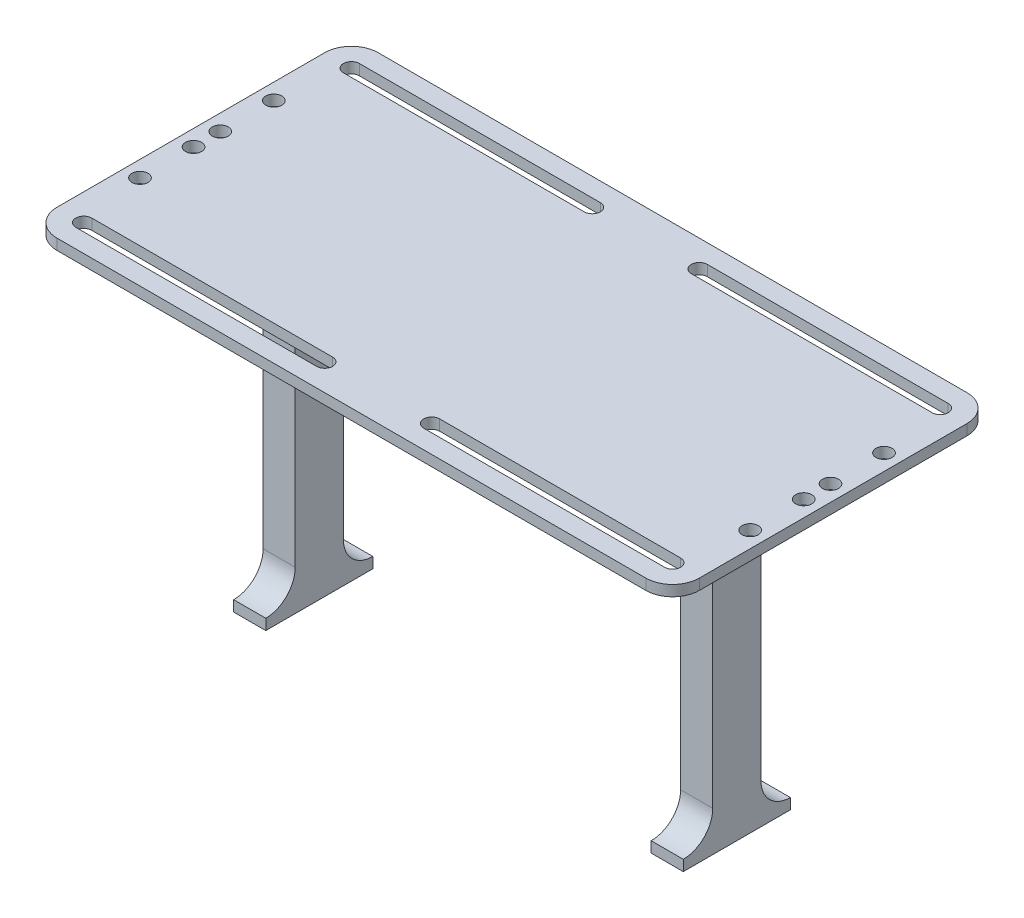
from build123d import *

# Parameters (mm, degrees)
SKETCH1_W             = 6
SKETCH1_H             = 9
BOSS_EXTRUDE1_DEPTH   = 60
BOSS_EXTRUDE1_2_DEPTH = 60
SKETCH2_W             = 6
SKETCH2_H             = 20
BOSS_EXTRUDE2_DEPTH   = 2
SKETCH3_R             = 1.4
CUT_EXTRUDE1_DEPTH    = 6
FILLET1_R             = 5.5
FILLET2_R             = 5.5
SKETCH4_R             = 1.5
BOSS_EXTRUDE4_DEPTH   = 2
FILLET4_R             = 10


with BuildPart() as part:
    # Sketch1 → Boss-Extrude1 (new body)
    with BuildSketch(Plane(origin=(0, 0, 0), x_dir=(1, 0, 0), z_dir=(0, 1, 0))):
        with Locations((39, 0)):
            Rectangle(SKETCH1_W, SKETCH1_H)
    extrude(amount=BOSS_EXTRUDE1_DEPTH)



with BuildPart() as body_2:
    # Sketch1 → Boss-Extrude1 2 (new body)
    with BuildSketch(Plane(origin=(0, 0, 0), x_dir=(1, 0, 0), z_dir=(0, 1, 0))):
        with Locations((-39, 0)):
            Rectangle(SKETCH1_W, SKETCH1_H)
    extrude(amount=BOSS_EXTRUDE1_2_DEPTH)


with BuildPart() as part_1:
    add(part.part)

    add(body_2.part)  # Boss-Extrude2 merges body 2
    # Sketch2 → Boss-Extrude2 (add)
    with BuildSketch(Plane.XZ):
        with Locations((-39, 0)):
            Rectangle(SKETCH2_W, SKETCH2_H)
        with Locations((39, 0)):
            Rectangle(SKETCH2_W, SKETCH2_H)
    extrude(amount=BOSS_EXTRUDE2_DEPTH)

    # Sketch3 → Cut-Extrude1 (cut)
    with BuildSketch(Plane.XZ.offset(2)):
        with Locations(Location((39, 0, 0), (0, 0, 270))):
            Circle(SKETCH3_R)
        with Locations(Location((-39, 0, 0), (0, 0, 270))):
            Circle(SKETCH3_R)
    extrude(amount=-CUT_EXTRUDE1_DEPTH, mode=Mode.SUBTRACT)

    # Fillet1
    fillet1_edges = [part_1.edges().sort_by_distance(p)[0] for p in [
        (-39, 0, -4.5),
        (-39, 0, 4.5),
    ]]
    fillet(fillet1_edges, radius=FILLET1_R - 0.0001)  # a hair under: the kernel refuses the full size

    # Fillet2
    fillet2_edges = [part_1.edges().sort_by_distance(p)[0] for p in [
        (39, 0, -4.5),
        (39, 0, 4.5),
    ]]
    fillet(fillet2_edges, radius=FILLET2_R - 0.0001)  # a hair under: the kernel refuses the full size

    # Sketch4 → Boss-Extrude4 (add)
    with BuildSketch(Plane(origin=(0, 60, 0), x_dir=(1, 0, 0), z_dir=(0, 1, 0))):
        with BuildLine():
            Line((-55, 30), (55, 30))
            ThreePointArc((55, 30), (58.535533906, 28.535533906), (60, 25))
            Line((60, 25), (60, -25))
            ThreePointArc((60, -25), (58.535533906, -28.535533906), (55, -30))
            Line((55, -30), (-55, -30))
            ThreePointArc((-55, -30), (-58.535533906, -28.535533906), (-60, -25))
            Line((-60, -25), (-60, 25))
            ThreePointArc((-60, 25), (-58.535533906, 28.535533906), (-55, 30))
        make_face()
        with Locations(Location((-57, -2.5, 0), (0, 0, 270))):
            Circle(SKETCH4_R, mode=Mode.SUBTRACT)
        with Locations(Location((-57, -12.5, 0), (0, 0, 270))):
            Circle(SKETCH4_R, mode=Mode.SUBTRACT)
        with Locations(Location((57, -12.5, 0), (0, 0, 270))):
            Circle(SKETCH4_R, mode=Mode.SUBTRACT)
        with Locations(Location((57, -2.5, 0), (0, 0, 270))):
            Circle(SKETCH4_R, mode=Mode.SUBTRACT)
        with Locations(Location((57, 2.5, 0), (0, 0, 270))):
            Circle(SKETCH4_R, mode=Mode.SUBTRACT)
        with Locations(Location((57, 12.5, 0), (0, 0, 270))):
            Circle(SKETCH4_R, mode=Mode.SUBTRACT)
        with Locations(Location((-57, 12.5, 0), (0, 0, 270))):
            Circle(SKETCH4_R, mode=Mode.SUBTRACT)
        with Locations(Location((-57, 2.5, 0), (0, 0, 270))):
            Circle(SKETCH4_R, mode=Mode.SUBTRACT)
        with BuildLine():
            Line((55, 23.5), (10, 23.5))
            ThreePointArc((10, 23.5), (8.5, 25), (10, 26.5))
            Line((10, 26.5), (55, 26.5))
            ThreePointArc((55, 26.5), (56.5, 25), (55, 23.5))
        make_face(mode=Mode.SUBTRACT)
        with BuildLine():
            Line((-55, -23.5), (-10, -23.5))
            ThreePointArc((-10, -23.5), (-8.5, -25), (-10, -26.5))
            Line((-10, -26.5), (-55, -26.5))
            ThreePointArc((-55, -26.5), (-56.5, -25), (-55, -23.5))
        make_face(mode=Mode.SUBTRACT)
        with BuildLine():
            Line((-55, 23.5), (-10, 23.5))
            ThreePointArc((-10, 23.5), (-8.5, 25), (-10, 26.5))
            Line((-10, 26.5), (-55, 26.5))
            ThreePointArc((-55, 26.5), (-56.5, 25), (-55, 23.5))
        make_face(mode=Mode.SUBTRACT)
        with BuildLine():
            Line((55, -23.5), (10, -23.5))
            ThreePointArc((10, -23.5), (8.5, -25), (10, -26.5))
            Line((10, -26.5), (55, -26.5))
            ThreePointArc((55, -26.5), (56.5, -25), (55, -23.5))
        make_face(mode=Mode.SUBTRACT)
    extrude(amount=BOSS_EXTRUDE4_DEPTH)

    # Fillet4
    fillet4_edges = [part_1.edges().sort_by_distance(p)[0] for p in [
        (39, 60, 4.5),
        (39, 60, -4.5),
        (-39, 60, -4.5),
        (-39, 60, 4.5),
    ]]
    fillet(fillet4_edges, radius=FILLET4_R)


solid = part_1.part
